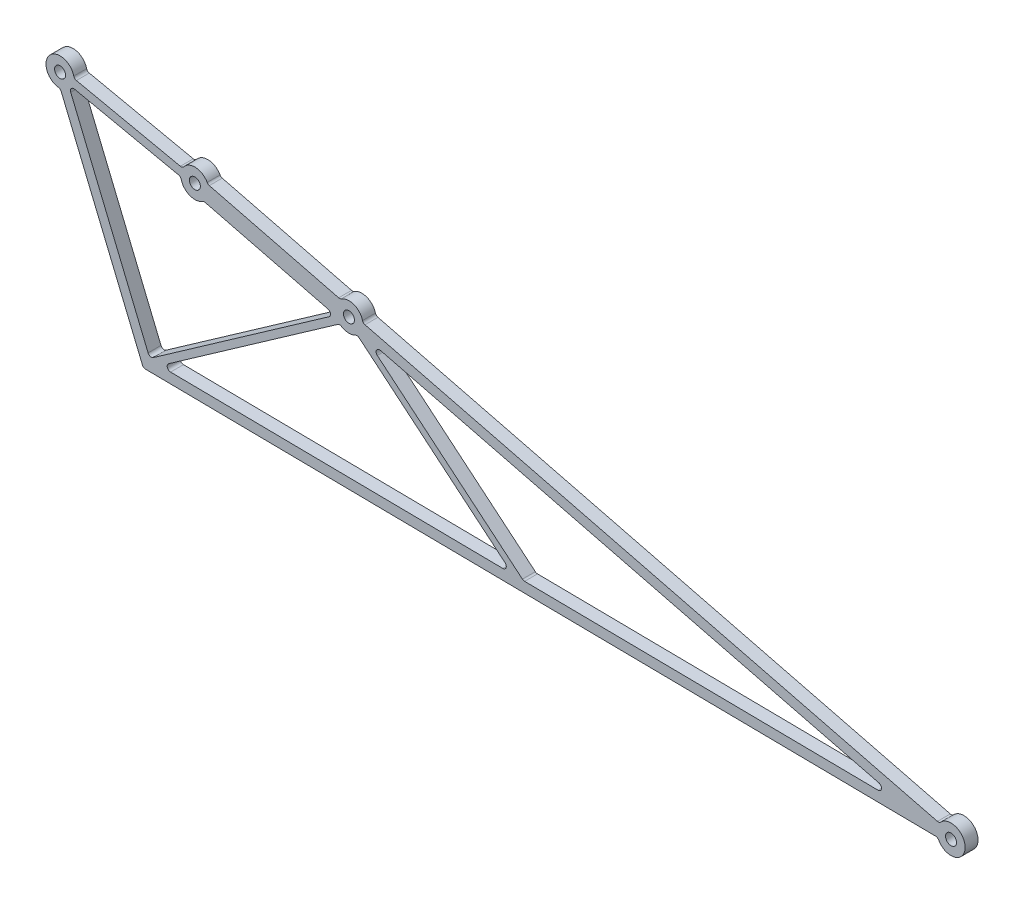
from build123d import *
from build123d.topology import SkipClean

# Parameters (mm, degrees)
SKETCH1_R               = 4.064
BOSS_EXTRUDE1_DEPTH     = 4.7625
CUT_EXTRUDE2_DEPTH      = 690.973625243
CUT_EXTRUDE2_DEPTH_BACK = 690.973625243
FILLET5_R               = 2.54


with BuildPart() as part:
    # Sketch1 → Boss-Extrude1 (new, symmetric)
    with BuildSketch(Plane.XY):
        with BuildLine():
            Line((-668.166397408, 161.616774863), (-668.166397408, 18.64362624))
            Line((-668.166397408, 18.64362624), (-87.838367094, -105.574938169))
            Line((-87.838367094, -105.574938169), (7.477398085, -7.248442169))
            ThreePointArc((7.477398085, -7.248442169), (10.016034099, 2.851395611), (2.538636014, 10.09983778))
            Line((2.538636014, 10.09983778), (-555.710049471, 150.417954639))
            ThreePointArc((-555.710049471, 150.417954639), (-555.889133178, 150.461287413), (-556.068955499, 150.501445056))
            Line((-556.068955499, 150.501445056), (-655.572667421, 171.800103061))
            ThreePointArc((-655.572667421, 171.800103061), (-664.300362279, 169.714648167), (-668.166397408, 161.616774863))
        make_face()
        with Locations(Location((-444.5, 111.726914125, 0), (0, 0, 180))):
            Circle(SKETCH1_R, mode=Mode.SUBTRACT)
        with Locations(Location((-657.752397408, 161.616774863, 0), (0, 0, 180))):
            Circle(SKETCH1_R, mode=Mode.SUBTRACT)
        with Locations(Location((0, 0, 0), (0, 0, 180))):
            Circle(SKETCH1_R, mode=Mode.SUBTRACT)
        with Locations(Location((-558.248685485, 140.318116858, 0), (0, 0, 180))):
            Circle(SKETCH1_R, mode=Mode.SUBTRACT)
    extrude(amount=BOSS_EXTRUDE1_DEPTH, both=True)

    # Sketch3 → Cut-Extrude2 (cut, two sides: drawn at the far end of the back side and taken through both)
    with SkipClean():  # the faces are left unmerged after this step: merging them gives an invalid solid
        with BuildSketch(Plane.XY.offset(-CUT_EXTRUDE2_DEPTH_BACK)):
            with BuildLine():
                Line((-441.961363863, 121.826751874), (-555.710049471, 150.417954639))
                ThreePointArc((-555.710049471, 150.417954639), (-551.509786292, 148.257804111), (-548.695715232, 144.464459263))
                Line((-548.695715232, 144.464459263), (-450.957072675, 119.897447062))
                ThreePointArc((-450.957072675, 119.897447062), (-446.683824739, 121.909364985), (-441.961363863, 121.826751874))
            make_face()
            with BuildLine():
                Line((2.538636014, 10.09983778), (-441.961363863, 121.826751874))
                ThreePointArc((-441.961363863, 121.826751874), (-436.714943747, 118.643871197), (-434.171590545, 113.059338277))
                Line((-434.171590545, 113.059338277), (-8.470870908, 6.057701053))
                ThreePointArc((-8.470870908, 6.057701053), (-3.589229728, 9.775930951), (2.538636014, 10.09983778))
            make_face()
            with BuildLine():
                ThreePointArc((-567.282647841, 145.498746179), (-562.491547061, 149.8286122), (-556.068955499, 150.501445056))
                Line((-556.068955499, 150.501445056), (-655.572667421, 171.800103061))
                ThreePointArc((-655.572667421, 171.800103061), (-649.98823881, 168.557180995), (-647.389331402, 162.645492005))
                Line((-647.389331402, 162.645492005), (-567.282647841, 145.498746179))
            make_face()
            with BuildLine():
                Line((-454.629375008, 107.72545344), (-551.79161281, 132.147583922))
                ThreePointArc((-551.79161281, 132.147583922), (-562.318768923, 130.73240787), (-568.611751491, 139.289399717))
                Line((-568.611751491, 139.289399717), (-648.718435052, 156.436145543))
                ThreePointArc((-648.718435052, 156.436145543), (-649.539598332, 155.213546979), (-650.525019748, 154.119014654))
                Line((-650.525019748, 154.119014654), (-591.564686258, 11.691300387))
                Line((-591.564686258, 11.691300387), (-454.629375008, 107.72545344))
            make_face()
            with BuildLine():
                ThreePointArc((-657.565596078, 151.204450375), (-665.04986433, 154.187214141), (-668.166397408, 161.616774863))
                Line((-668.166397408, 161.616774863), (-668.166397408, 18.64362624))
                Line((-668.166397408, 18.64362624), (-596.32392942, 3.265826494))
                Line((-596.32392942, 3.265826494), (-657.565596078, 151.204450375))
            make_face()
            with BuildLine():
                Line((-87.838367094, -105.574938169), (7.477398085, -7.248442169))
                ThreePointArc((7.477398085, -7.248442169), (-2.105505073, -10.198933493), (-9.73654702, -3.694732483))
                Line((-9.73654702, -3.694732483), (-596.32392942, 3.265826494))
                Line((-596.32392942, 3.265826494), (-87.838367094, -105.574938169))
            make_face()
            with BuildLine():
                ThreePointArc((-438.373626695, 103.305575388), (-444.936585447, 101.322069621), (-451.310312416, 103.848396447))
                Line((-451.310312416, 103.848396447), (-584.072378221, 10.740983679))
                Line((-584.072378221, 10.740983679), (-323.761303231, 7.652082274))
                Line((-323.761303231, 7.652082274), (-438.373626695, 103.305575388))
            make_face()
            Polygon((-32.313863809, 4.193710765), (-432.091689332, 104.679521297), (-315.718749539, 7.556647781), align=None)
        extrude(amount=CUT_EXTRUDE2_DEPTH + CUT_EXTRUDE2_DEPTH_BACK, mode=Mode.SUBTRACT)

    # Fillet5
    # the kernel refuses this fillet: 2.54 mm, written as the material it adds along each edge
    with BuildSketch(Plane(origin=(-432.091689332, 104.679521297, 4.7625), x_dir=(0.9698327040744903, -0.24377146286545154, 0), z_dir=(0, 0, -1))) as fillet5_piece_1:
        with BuildLine():
            CenterArc((FILLET5_R * 4.37701255665, FILLET5_R), FILLET5_R, 115.738557535, 154.261442465)
            Line((FILLET5_R * 3.94274718517, FILLET5_R * 1.90078498386), (0, 0))
            Line((0, 0), (FILLET5_R * 4.37701255665, 0))
        make_face()
    extrude(amount=9.525)
    with BuildSketch(Plane(origin=(-32.313863809, 4.193710765, -4.7625), x_dir=(-0.9698327040744894, 0.24377146286545465, 0), z_dir=(0, 0, 1))) as fillet5_piece_2:
        with BuildLine():
            CenterArc((FILLET5_R * 8.4937923688, FILLET5_R), FILLET5_R, 103.429391771, 166.570608229)
            Line((FILLET5_R * 8.26154547816, FILLET5_R * 1.97265686744), (0, 0))
            Line((0, 0), (FILLET5_R * 8.4937923688, 0))
        make_face()
    extrude(amount=9.525)
    with BuildSketch(Plane(origin=(-315.718749539, 7.556647781, 4.7625), x_dir=(-0.7677492318062843, 0.6407504327434048, 0), z_dir=(0, 0, -1))) as fillet5_piece_3:
        with BuildLine():
            CenterArc((FILLET5_R * 0.355768854879, FILLET5_R), FILLET5_R, 230.832050694, 39.167949306)
            Line((-FILLET5_R * 0.275826852618, FILLET5_R * 0.224702081603), (0, 0))
            Line((0, 0), (FILLET5_R * 0.355768854879, 0))
        make_face()
    extrude(amount=9.525)
    with BuildSketch(Plane(origin=(-450.957072675, 119.897447062, 4.7625), x_dir=(-0.9698327040744915, 0.24377146286544657, 0), z_dir=(0, 0, -1))) as fillet5_piece_4:
        with BuildLine():
            CenterArc((1.167973372, 2.54), FILLET5_R, 223.335922736, 46.664077264)
            ThreePointArc((-0.679476901, 0.796862745), (-0.329715617, 0.406977742), (0, 0))
            Line((0, 0), (1.167973372, 0))
        make_face()
    extrude(amount=9.525)
    with BuildSketch(Plane(origin=(-548.695715232, 144.464459263, -4.7625), x_dir=(-0.44376973183337304, 0.8961408511548484, 0), z_dir=(0, 0, 1))) as fillet5_piece_5:
        with BuildLine():
            CenterArc((1.174934772, -2.536787354), FILLET5_R, 92.882026708, 46.664077264)
            Line((-0.75782313, -0.888744002), (0, 0))
            ThreePointArc((0, 0), (0.523612236, -0.013171849), (1.047224471, 0))
        make_face()
    extrude(amount=9.525)
    with BuildSketch(Plane(origin=(-9.73654702, -3.694732483, 4.7625), x_dir=(0.4182943281117258, -0.9083115407554614, 0), z_dir=(0, 0, -1)), Plane(origin=(-650.525019748, 154.119014654, 4.7625), x_dir=(0.670494914726067, 0.7419141253045962, 0), z_dir=(0, 0, -1))) as fillet5_piece_6:
        with BuildLine():
            CenterArc((1.608371465, 2.533976504), FILLET5_R, 205.406798902, 60.646529945)
            Line((-0.68597088, 1.444209004), (0, 0))
            ThreePointArc((0, 0), (0.71677424, 0.024696333), (1.43354848, 0))
        make_face()
    extrude(amount=9.525)
    with BuildSketch(Plane(origin=(-647.389331402, 162.645492005, 4.7625), x_dir=(-0.17163878928589119, 0.985159949456165, 0), z_dir=(0, 0, -1))) as fillet5_piece_7:
        with BuildLine():
            CenterArc((1.717153467, 2.533133012), FILLET5_R, 201.964897943, 63.821031296)
            Line((-0.638476016, 1.583075254), (0, 0))
            ThreePointArc((0, 0), (0.765253175, 0.028154653), (1.530506351, 0))
        make_face()
    extrude(amount=9.525)
    with BuildSketch(Plane(origin=(-567.282647841, 145.498746179, -4.7625), x_dir=(-0.9778498365567232, 0.20930766146032473, 0), z_dir=(0, 0, 1))) as fillet5_piece_8:
        with BuildLine():
            CenterArc((1.706979462, -2.54), FILLET5_R, 90, 63.821031296)
            ThreePointArc((-0.57246828, -1.419411765), (-0.260123144, -0.720236806), (0, 0))
            Line((0, 0), (1.706979462, 0))
        make_face()
    extrude(amount=9.525)
    with BuildSketch(Plane(origin=(-648.718435052, 156.436145543, 4.7625), x_dir=(0.9778498365567261, -0.20930766146031107, 0), z_dir=(0, 0, -1))) as fillet5_piece_9:
        with BuildLine():
            CenterArc((1.706979462, 2.54), FILLET5_R, 206.178968704, 63.821031296)
            ThreePointArc((-0.57246828, 1.419411765), (-0.260123144, 0.720236806), (0, 0))
            Line((0, 0), (1.706979462, 0))
        make_face()
    extrude(amount=9.525)
    with BuildSketch(Plane(origin=(-568.611751491, 139.289399717, -4.7625), x_dir=(0.1716387892858222, -0.9851599494561769, 0), z_dir=(0, 0, 1))) as fillet5_piece_10:
        with BuildLine():
            CenterArc((1.717153467, -2.533133012), FILLET5_R, 94.214070761, 63.821031296)
            Line((-0.638476016, -1.583075254), (0, 0))
            ThreePointArc((0, 0), (0.765253175, -0.028154653), (1.530506351, 0))
        make_face()
    extrude(amount=9.525)
    with BuildSketch(Plane(origin=(-551.79161281, 132.147583922, -4.7625), x_dir=(0.9698327040744915, -0.24377146286544651, 0), z_dir=(0, 0, 1))) as fillet5_piece_11:
        with BuildLine():
            CenterArc((1.167973372, -2.54), FILLET5_R, 90, 46.664077264)
            ThreePointArc((-0.679476901, -0.796862745), (-0.329715617, -0.406977742), (0, 0))
            Line((0, 0), (1.167973372, 0))
        make_face()
    extrude(amount=9.525)
    with BuildSketch(Plane(origin=(-454.629375008, 107.72545344, -4.7625), x_dir=(-0.9698327040744891, 0.24377146286545595, 0), z_dir=(0, 0, 1))) as fillet5_piece_12:
        with BuildLine():
            CenterArc((FILLET5_R * 2.18662804116, FILLET5_R), FILLET5_R, 139.151619975, 130.848380025)
            Line((FILLET5_R * 1.4301849976, FILLET5_R * 1.65405957057), (0, 0))
            Line((0, 0), (FILLET5_R * 2.18662804116, 0))
        make_face()
    extrude(amount=9.525)
    with BuildSketch(Plane(origin=(-591.564686258, 11.691300387, 4.7625), x_dir=(-0.38248875056705317, 0.9239601483233217, 0), z_dir=(0, 0, -1))) as fillet5_piece_13:
        with BuildLine():
            CenterArc((FILLET5_R * 1.24718774025, FILLET5_R), FILLET5_R, 167.445549697, 102.554450303)
            Line((FILLET5_R * 0.271097864551, FILLET5_R * 1.21736732635), (0, 0))
            Line((0, 0), (FILLET5_R * 1.24718774025, 0))
        make_face()
    extrude(amount=9.525)
    with BuildSketch(Plane(origin=(-451.310312416, 103.848396447, -4.7625), x_dir=(0.8053622455004413, -0.5927829733743091, 0), z_dir=(0, 0, 1))) as fillet5_piece_14:
        with BuildLine():
            CenterArc((1.827697503, -2.532219008), FILLET5_R, 94.485895933, 66.911227563)
            Line((-0.579593582, -1.721941504), (0, 0))
            ThreePointArc((0, 0), (0.814517365, -0.031902068), (1.629034731, 0))
        make_face()
    extrude(amount=9.525)
    with BuildSketch(Plane(origin=(-438.373626695, 103.305575388, -4.7625), x_dir=(-0.8521900532222071, -0.5232323701656196, 0), z_dir=(0, 0, 1))) as fillet5_piece_15:
        with BuildLine():
            CenterArc((1.827697503, 2.532219008), FILLET5_R, 198.602876504, 66.911227563)
            Line((-0.579593582, 1.721941504), (0, 0))
            ThreePointArc((0, 0), (0.814517365, 0.031902068), (1.629034731, 0))
        make_face()
    extrude(amount=9.525)
    with BuildSketch(Plane(origin=(-323.761303231, 7.652082274, 4.7625), x_dir=(-0.9999296041682059, 0.011865357475233242, 0), z_dir=(0, 0, -1))) as fillet5_piece_16:
        with BuildLine():
            CenterArc((FILLET5_R * 2.8108137806, FILLET5_R), FILLET5_R, 129.167949306, 140.832050694)
            Line((FILLET5_R * 2.1792180731, FILLET5_R * 1.7752979184), (0, 0))
            Line((0, 0), (FILLET5_R * 2.8108137806, 0))
        make_face()
    extrude(amount=9.525)
    with BuildSketch(Plane(origin=(-584.072378221, 10.740983679, 4.7625), x_dir=(0.8187275892564178, 0.5741821440887678, 0), z_dir=(0, 0, -1))) as fillet5_piece_17:
        with BuildLine():
            CenterArc((FILLET5_R * 3.10325901667, FILLET5_R), FILLET5_R, 125.722228204, 144.277771796)
            Line((FILLET5_R * 2.51940279709, FILLET5_R * 1.81185707785), (0, 0))
            Line((0, 0), (FILLET5_R * 3.10325901667, 0))
        make_face()
    extrude(amount=9.525)
    with BuildSketch(Plane(origin=(-8.470870908, 6.057701053, 4.7625), x_dir=(-0.9698327040744897, 0.2437714628654535, 0), z_dir=(0, 0, -1))) as fillet5_piece_18:
        with BuildLine():
            CenterArc((1.598841985, 2.54), FILLET5_R, 209.353470055, 60.646529945)
            ThreePointArc((-0.61505297, 1.294901961), (-0.285218673, 0.658046752), (0, 0))
            Line((0, 0), (1.598841985, 0))
        make_face()
    extrude(amount=9.525)
    with BuildSketch(Plane(origin=(-434.171590545, 113.059338277, -4.7625), x_dir=(-0.19590431977265832, 0.9806230149728344, 0), z_dir=(0, 0, 1)), Plane(origin=(-657.565596078, 151.204450375, 4.7625), x_dir=(-0.9987026389046928, 0.05092189160668163, 0), z_dir=(0, 0, -1))) as fillet5_piece_19:
        with BuildLine():
            CenterArc((1.608371465, -2.533976504), FILLET5_R, 93.946671153, 60.646529945)
            Line((-0.68597088, -1.444209004), (0, 0))
            ThreePointArc((0, 0), (0.71677424, -0.024696333), (1.43354848, 0))
        make_face()
    extrude(amount=9.525)
    # the kernel refuses this fillet: 2.54 mm, written as the material it takes off along each edge
    with BuildSketch(Plane(origin=(-596.32392942, 3.265826494, -8.952115902), x_dir=(0.999929604168206, -0.011865357475233589, 0), z_dir=(0, 0, 1))) as fillet5_2_piece_1:
        with BuildLine():
            CenterArc((FILLET5_R * 0.659782031773, FILLET5_R), FILLET5_R, 203.167777901, 66.832222099)
            Line((-FILLET5_R * 0.259574707851, FILLET5_R * 0.606575057594), (0, 0))
            Line((0, 0), (FILLET5_R * 0.659782031773, 0))
        make_face()
    extrude(amount=17.904231804, mode=Mode.SUBTRACT)


solid = part.part
